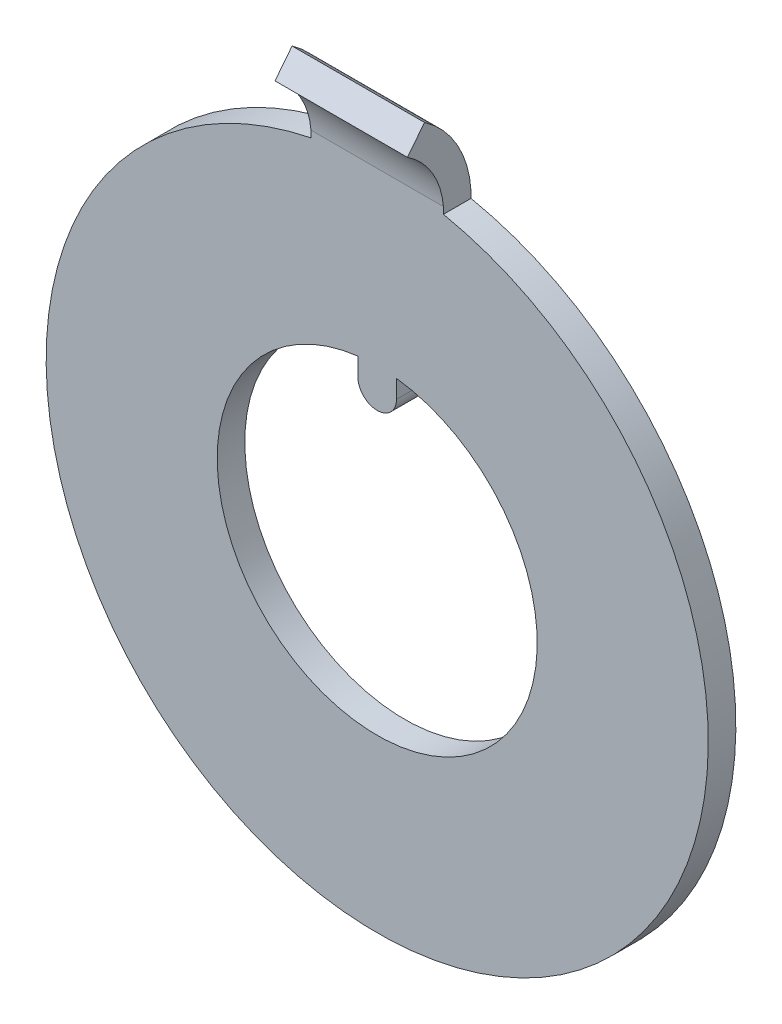
from build123d import *

# Parameters (mm, degrees)
SKETCH1_R           = 6
BOSS_EXTRUDE1_DEPTH = 0.5
BOSS_EXTRUDE2_START = -0.121225
SKETCH2_W           = 2.4
SKETCH2_H           = 0.5
BOSS_EXTRUDE2_DEPTH = 0.121225
SWEEP1_START        = -1.2
SWEEP1_DEPTH        = 2.4


# Read off the part's stored shape, not the designer's step: Sweep1
with BuildPart() as part:
    # Sketch1 → Boss-Extrude1 (new body)
    with BuildSketch(Plane.XY):
        Circle(SKETCH1_R)
        with BuildLine():
            Line((-0.35, 2.878801834), (-0.35, 2.55))
            ThreePointArc((-0.35, 2.55), (0, 2.2), (0.35, 2.55))
            Line((0.35, 2.55), (0.35, 2.878801834))
            ThreePointArc((0.35, 2.878801834), (0, -2.9), (-0.35, 2.878801834))
        make_face(mode=Mode.SUBTRACT)
    extrude(amount=BOSS_EXTRUDE1_DEPTH)

    # Sketch2 → Boss-Extrude2 (add)
    with BuildSketch(Plane(origin=(0, 6, 0), x_dir=(1, 0, 0), z_dir=(0, 1, 0)).offset(BOSS_EXTRUDE2_START)):
        with Locations((0, -0.25)):
            Rectangle(SKETCH2_W, SKETCH2_H)
    extrude(amount=BOSS_EXTRUDE2_DEPTH)

    # Sweep1 outline → Sweep1 (add)
    with BuildSketch(Plane.YZ.offset(SWEEP1_START)):
        with BuildLine():
            ThreePointArc((6, 0), (6.842994327, 0.249762545), (7.492047788, 0.84284801))
            Line((7.492047788, 0.84284801), (7.098940121, 1.151824324))
            ThreePointArc((7.098940121, 1.151824324), (6.624463044, 0.699478098), (6, 0.5))
            Line((6, 0.5), (6, 0))
        make_face()
    extrude(amount=SWEEP1_DEPTH)


solid = part.part
